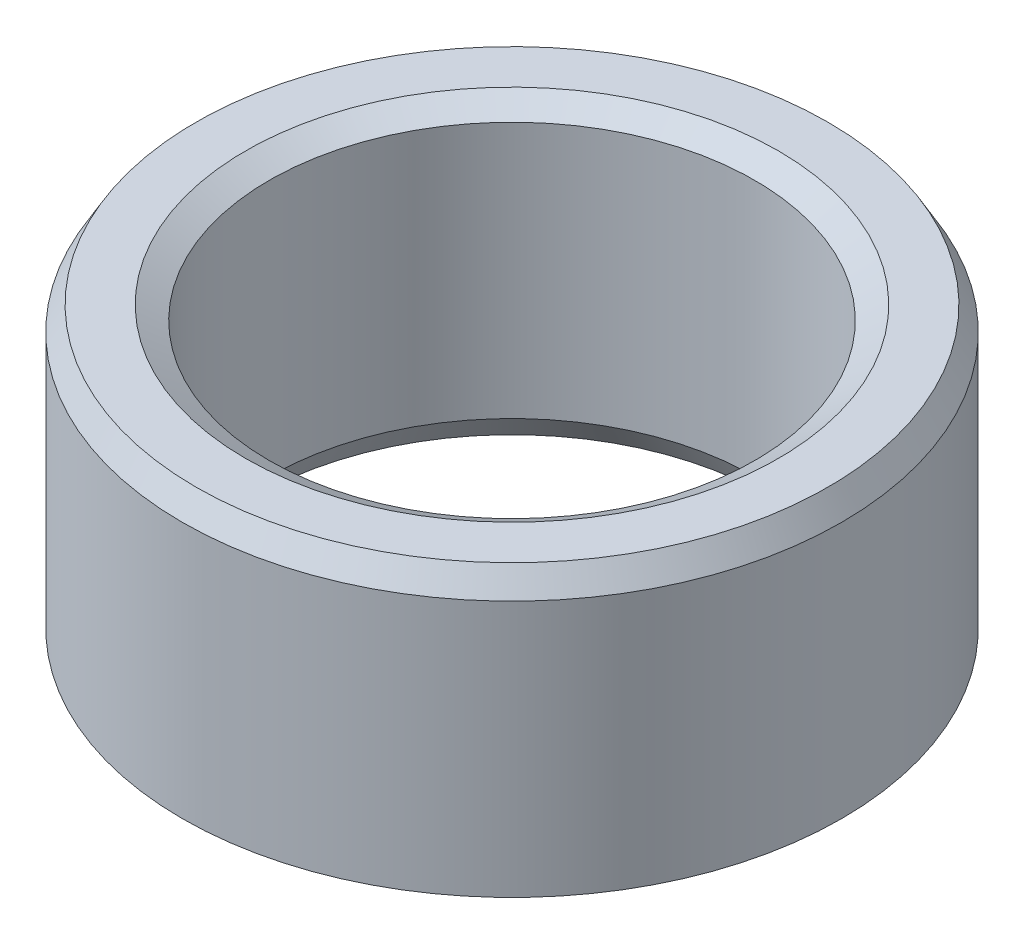
from build123d import *
from OCP.BRepFilletAPI import BRepFilletAPI_MakeChamfer

# Parameters (mm, degrees)
SKETCH1_R           = 40
BOSS_EXTRUDE1_DEPTH = 35.660416635
SKETCH2_R           = 29.45332271
CUT_EXTRUDE1_DEPTH  = 67.870511547
CHAMFER1_SIZE       = 2.870249318
CHAMFER1_SIZE2      = 1.657139216


with BuildPart() as part:
    # Sketch1 → Boss-Extrude1 (new body)
    with BuildSketch(Plane(origin=(0, 0, 0), x_dir=(1, 0, 0), z_dir=(0, 1, 0))):
        Circle(SKETCH1_R)
    extrude(amount=BOSS_EXTRUDE1_DEPTH)

    # Sketch2 → Cut-Extrude1 (cut, through all)
    with BuildSketch(Plane(origin=(0, 0, 0), x_dir=(1, 0, 0), z_dir=(0, 1, 0))):
        Circle(SKETCH2_R)
    extrude(amount=CUT_EXTRUDE1_DEPTH, mode=Mode.SUBTRACT)

    # Chamfer1: one chamfer whose edges measure the first distance from different faces: ONE call of the kernel's chamfer builder (chamfer() names one face for all edges)
    chamfer1_edges_1 = [part.edges().sort_by_distance(p)[0] for p in [
        (-29.45332271, 35.660416635, 0),
    ]]
    chamfer1_side_1 = [part.faces().sort_by_distance(p)[0] for p in [
        (-38.86862915, 35.660416635, 0),
    ]]
    chamfer1_edges_2 = [part.edges().sort_by_distance(p)[0] for p in [
        (-29.45332271, 0, 0),
    ]]
    chamfer1_side_2 = [part.faces().sort_by_distance(p)[0] for p in [
        (-29.45332271, 17.830208318, 0),
    ]]
    chamfer1_edges_3 = [part.edges().sort_by_distance(p)[0] for p in [
        (-40, 0, 0),
    ]]
    chamfer1_side_3 = [part.faces().sort_by_distance(p)[0] for p in [
        (-38.86862915, 0, 0),
    ]]
    chamfer1_edges_4 = [part.edges().sort_by_distance(p)[0] for p in [
        (-40, 35.660416635, 0),
    ]]
    chamfer1_side_4 = [part.faces().sort_by_distance(p)[0] for p in [
        (-40, 17.830208318, 0),
    ]]
    chamfer1 = BRepFilletAPI_MakeChamfer(part.part.solid().wrapped)
    for e in chamfer1_edges_1:
        chamfer1.Add(CHAMFER1_SIZE, CHAMFER1_SIZE2, e.wrapped, chamfer1_side_1[0].wrapped)  # the first distance lies on this face
    for e in chamfer1_edges_2:
        chamfer1.Add(CHAMFER1_SIZE, CHAMFER1_SIZE2, e.wrapped, chamfer1_side_2[0].wrapped)  # the first distance lies on this face
    for e in chamfer1_edges_3:
        chamfer1.Add(CHAMFER1_SIZE, CHAMFER1_SIZE2, e.wrapped, chamfer1_side_3[0].wrapped)  # the first distance lies on this face
    for e in chamfer1_edges_4:
        chamfer1.Add(CHAMFER1_SIZE, CHAMFER1_SIZE2, e.wrapped, chamfer1_side_4[0].wrapped)  # the first distance lies on this face
    add(Compound.cast(chamfer1.Shape()), mode=Mode.REPLACE)


solid = part.part
